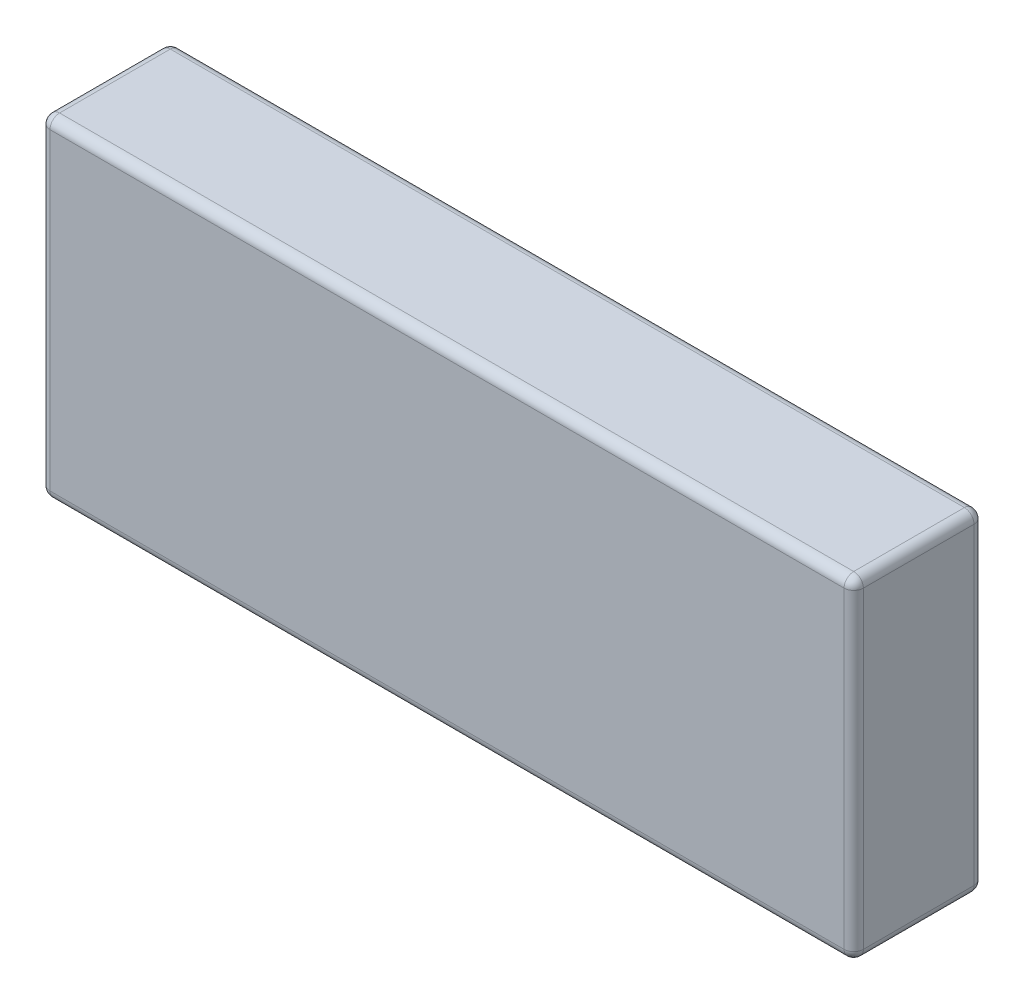
from build123d import *

# Parameters (mm, degrees)
SKETCH1_W           = 169
SKETCH1_H           = 27
BOSS_EXTRUDE1_DEPTH = 69
FILLET1_R           = 2


with BuildPart() as part:
    # Sketch1 → Boss-Extrude1 (new body)
    with BuildSketch(Plane(origin=(0, 0, 0), x_dir=(1, 0, 0), z_dir=(0, 1, 0))):
        with Locations((84.5, 13.5)):
            Rectangle(SKETCH1_W, SKETCH1_H)
    extrude(amount=BOSS_EXTRUDE1_DEPTH)

    # Fillet1
    fillet1_edges = [part.edges().sort_by_distance(p)[0] for p in [
        (0, 34.5, 0),
        (169, 34.5, 0),
        (84.5, 0, 0),
        (169, 0, -13.5),
        (0, 0, -13.5),
        (169, 69, -13.5),
        (84.5, 69, 0),
        (0, 69, -13.5),
        (169, 34.5, -27),
        (84.5, 69, -27),
        (0, 34.5, -27),
        (84.5, 0, -27),
    ]]
    fillet(fillet1_edges, radius=FILLET1_R)


solid = part.part
